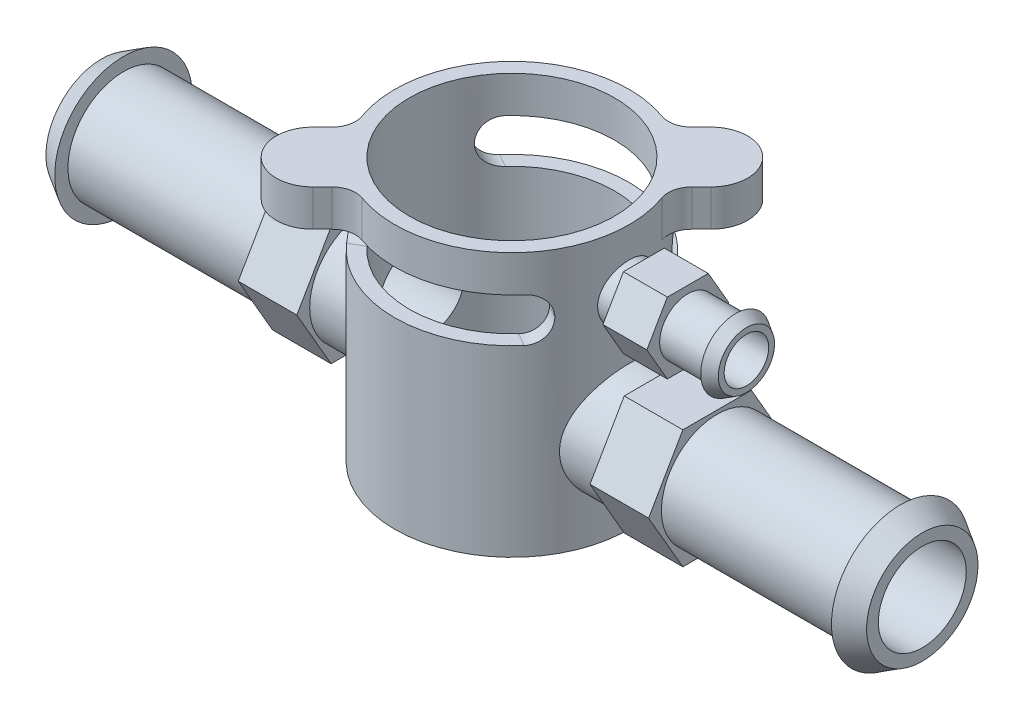
from build123d import *

# Parameters (mm, degrees)
SKETCH1_R               = 25.4
BOSS_EXTRUDE1_DEPTH     = 57.15
SKETCH2_R               = 12.065
BOSS_EXTRUDE2_DEPTH     = 88.9
SKETCH2_3_R             = 6.096
BOSS_EXTRUDE3_DEPTH     = 50.8
BOSS_EXTRUDE5_START     = 31.75
BOSS_EXTRUDE5_DEPTH     = 12.7
BOSS_EXTRUDE6_START     = 28.575
BOSS_EXTRUDE6_DEPTH     = 9.525
SKETCH8_R               = 22.225
CUT_EXTRUDE2_DEPTH      = 53.975
CUT_EXTRUDE1_DEPTH      = 4.7625
FILLET2_R               = 4.7625
BOSS_EXTRUDE4_START     = -7.9375
BOSS_EXTRUDE4_DEPTH     = 7.9375
FILLET1_R               = 5.08
FILLET1_OF_MIRROR1_R    = 5.08
CUT_EXTRUDE3_DEPTH      = 110.72237409
CUT_EXTRUDE3_DEPTH_BACK = 110.72237409
SKETCH2_10_R            = 9.525
SKETCH2_12_R            = 4.826
CUT_EXTRUDE5_DEPTH      = 110.722374171


with BuildPart() as part:
    # Sketch1 → Boss-Extrude1 (new body)
    with BuildSketch(Plane(origin=(0, 0, 0), x_dir=(1, 0, 0), z_dir=(0, 1, 0))):
        with Locations(Location((0, 0, 0), (0, 0, 270))):
            Circle(SKETCH1_R)
    extrude(amount=BOSS_EXTRUDE1_DEPTH)

    # Sketch2 → Boss-Extrude2 (add)
    with BuildSketch(Plane(origin=(0, 0, 0), x_dir=(0, 0, -1), z_dir=(1, 0, 0))):
        with Locations(Location((0, 19.05, 0), (0, 0, 180))):
            Circle(SKETCH2_R)
    boss_extrude2 = extrude(amount=BOSS_EXTRUDE2_DEPTH)

    # Sketch2<3> → Boss-Extrude3 (add)
    with BuildSketch(Plane(origin=(0, 0, 0), x_dir=(0, 0, -1), z_dir=(1, 0, 0))):
        with Locations(Location((0, 44.45, 0), (0, 0, 180))):
            Circle(SKETCH2_3_R)
    extrude(amount=BOSS_EXTRUDE3_DEPTH)

    # Sketch3 → Revolve1 (revolve)
    with BuildSketch(Plane.XY, mode=Mode.PRIVATE) as revolve1_sk:
        Polygon((88.9, 31.115), (84.1375, 33.9725), (84.1375, 31.115), align=None)
    revolve1 = revolve(revolve1_sk.sketch.rotate(Axis((88.9, 19.05, 0), (-1, 0, 0)), 270), axis=Axis((88.9, 19.05, 0), (-1, 0, 0)))

    # Sketch4 → Revolve2 (revolve)
    with BuildSketch(Plane.XY, mode=Mode.PRIVATE) as revolve2_sk:
        Polygon((50.8, 50.546), (48.41875, 50.546), (48.41875, 51.97475), align=None)
    revolve(revolve2_sk.sketch.rotate(Axis((50.8, 44.45, 0), (-1, 0, 0)), 270), axis=Axis((50.8, 44.45, 0), (-1, 0, 0)))

    # Sketch2<13> → Boss-Extrude5 (add)
    with BuildSketch(Plane(origin=(0, 0, 0), x_dir=(0, 0, -1), z_dir=(1, 0, 0)).offset(BOSS_EXTRUDE5_START)):
        Polygon((-7.424002774, 31.90875), (-14.848005548, 19.05), (-7.424002774, 6.19125), (7.424002774, 6.19125), (14.848005548, 19.05), (7.424002774, 31.90875), align=None)
    boss_extrude5 = extrude(amount=BOSS_EXTRUDE5_DEPTH)

    # Sketch2<14> → Boss-Extrude6 (add)
    with BuildSketch(Plane(origin=(0, 0, 0), x_dir=(0, 0, -1), z_dir=(1, 0, 0)).offset(BOSS_EXTRUDE6_START)):
        Polygon((4.436070793, 52.1335), (-4.436070793, 52.1335), (-8.872141587, 44.45), (-4.436070793, 36.7665), (4.436070793, 36.7665), (8.872141587, 44.45), align=None)
    extrude(amount=BOSS_EXTRUDE6_DEPTH)

    # Mirror2: Boss-Extrude2, Revolve1, Boss-Extrude5 across plane
    add(boss_extrude2.mirror(Plane(origin=(0, 0, 0), x_dir=(0, 0, 1), z_dir=(1, 0, 0))))
    add(revolve1.mirror(Plane(origin=(0, 0, 0), x_dir=(0, 0, 1), z_dir=(1, 0, 0))))
    add(boss_extrude5.mirror(Plane(origin=(0, 0, 0), x_dir=(0, 0, 1), z_dir=(1, 0, 0))))

    # Sketch8 → Cut-Extrude2 (cut)
    with BuildSketch(Plane(origin=(0, 57.15, 0), x_dir=(1, 0, 0), z_dir=(0, 1, 0))):
        with Locations(Location((0, 0, 0), (0, 0, 270))):
            Circle(SKETCH8_R)
    extrude(amount=-CUT_EXTRUDE2_DEPTH, mode=Mode.SUBTRACT)

    # Sketch7 → Cut-Extrude1 (cut, symmetric)
    with BuildSketch(Plane(origin=(0, 44.45, 0), x_dir=(1, 0, 0), z_dir=(0, 1, 0))):
        with BuildLine():
            Line((19.247414599, 11.1125), (21.997045256, 12.7))
            ThreePointArc((21.997045256, 12.7), (0, 25.4), (-21.997045256, 12.7))
            Line((-21.997045256, 12.7), (-19.247414599, 11.1125))
            ThreePointArc((-19.247414599, 11.1125), (0, 22.225), (19.247414599, 11.1125))
        make_face()
        with BuildLine():
            Line((19.247414599, -11.1125), (21.997045256, -12.7))
            ThreePointArc((21.997045256, -12.7), (0, -25.4), (-21.997045256, -12.7))
            Line((-21.997045256, -12.7), (-19.247414599, -11.1125))
            ThreePointArc((-19.247414599, -11.1125), (0, -22.225), (19.247414599, -11.1125))
        make_face()
    extrude(amount=CUT_EXTRUDE1_DEPTH, both=True, mode=Mode.SUBTRACT)

    # Fillet2
    fillet2_edges = [part.edges().sort_by_distance(p)[0] for p in [
        (20.622229928, 49.2125, -11.90625),
        (20.622229928, 39.6875, -11.90625),
        (-20.622229928, 49.2125, -11.90625),
        (-20.622229928, 39.6875, -11.90625),
        (-20.622229928, 49.2125, 11.90625),
        (-20.622229928, 39.6875, 11.90625),
        (20.622229928, 49.2125, 11.90625),
        (20.622229928, 39.6875, 11.90625),
    ]]
    fillet(fillet2_edges, radius=FILLET2_R - 0.0001)  # a hair under: the kernel refuses the full size

    # Sketch5 → Boss-Extrude4 (add)
    with BuildSketch(Plane(origin=(0, 57.15, 0), x_dir=(1, 0, 0), z_dir=(0, 1, 0)).offset(BOSS_EXTRUDE4_START)):
        with BuildLine():
            Line((11.448349475, 22.673669626), (15.939954615, 27.165274766))
            ThreePointArc((15.939954615, 27.165274766), (27.165274766, 27.165274766), (27.165274766, 15.939954615))
            Line((27.165274766, 15.939954615), (22.673669626, 11.448349475))
            ThreePointArc((22.673669626, 11.448349475), (17.960512242, 17.960512242), (11.448349475, 22.673669626))
        make_face()
    boss_extrude4 = extrude(amount=BOSS_EXTRUDE4_DEPTH)

    # Fillet1
    fillet1_edges = [part.edges().sort_by_distance(p)[0] for p in [
        (22.673669626, 53.18125, -11.448349475),
        (11.448349475, 53.18125, -22.673669626),
    ]]
    fillet(fillet1_edges, radius=FILLET1_R)

    # Mirror1: Boss-Extrude4 across plane
    add(boss_extrude4.mirror(Plane(origin=(0, 0, 0), x_dir=(0.7071067811865478, 0, 0.7071067811865472), z_dir=(-0.7071067811865475, 0, 0.7071067811865477))))

    # Fillet1 of Mirror1
    fillet1_of_mirror1_edges = [part.edges().sort_by_distance(p)[0] for p in [
        (-11.448349475, 53.18125, 22.673669626),
        (-22.673669626, 53.18125, 11.448349475),
    ]]
    fillet(fillet1_of_mirror1_edges, radius=FILLET1_OF_MIRROR1_R)

    # Sketch2<10> → Cut-Extrude3 (cut, two sides: drawn at the far end of the back side and taken through both)
    with BuildSketch(Plane(origin=(0, 0, 0), x_dir=(0, 0, -1), z_dir=(1, 0, 0)).offset(-CUT_EXTRUDE3_DEPTH_BACK)):
        with Locations((0, 19.05)):
            Circle(SKETCH2_10_R)
    extrude(amount=CUT_EXTRUDE3_DEPTH + CUT_EXTRUDE3_DEPTH_BACK, mode=Mode.SUBTRACT)

    # Sketch2<12> → Cut-Extrude5 (cut, through all)
    with BuildSketch(Plane(origin=(0, 0, 0), x_dir=(0, 0, -1), z_dir=(1, 0, 0))):
        with Locations(Location((0, 44.45, 0), (0, 0, 180))):
            Circle(SKETCH2_12_R)
    extrude(amount=CUT_EXTRUDE5_DEPTH, mode=Mode.SUBTRACT)


solid = part.part
